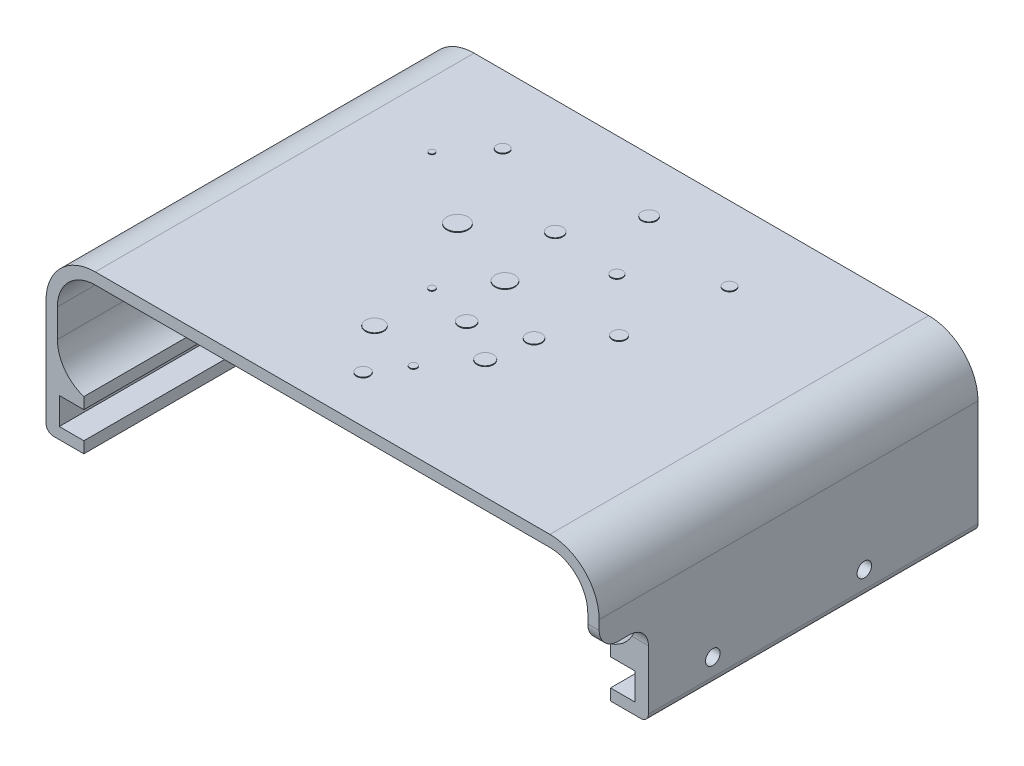
from build123d import *

# Parameters (mm, degrees)
BOSS_EXTRUDE1_DEPTH = 100
SKETCH2_R           = 1.925
CUT_EXTRUDE1_DEPTH  = 181.013888353
SKETCH3_W           = 10
SKETCH3_H           = 22.639392014
CUT_EXTRUDE2_DEPTH  = 13
FILLET1_R           = 5
SKETCH4_R           = 1.733173836
SKETCH4_R_2         = 0.981586666
SKETCH4_R_3         = 2.392571232
SKETCH4_R_4         = 2.109303231
SKETCH4_R_5         = 2.027090755
SKETCH4_R_6         = 2.155813145
SKETCH4_R_7         = 2.801748037
SKETCH4_R_8         = 1.588123218
SKETCH4_R_9         = 1.944759062
SKETCH4_R_10        = 2.597034209
SKETCH4_R_11        = 0.847315687
SKETCH4_R_12        = 1.785604619
SKETCH4_R_13        = 1.51506652
SKETCH4_R_14        = 2.019517128
SKETCH4_R_15        = 0.753353873
BOSS_EXTRUDE2_DEPTH = 0.2


with BuildPart() as part:
    # Sketch1 → Boss-Extrude1 (new body)
    with BuildSketch(Plane.XY):
        with BuildLine():
            Line((-63, -7.1), (-63, -10.1))
            Line((-63, -10.1), (-71, -10.1))
            ThreePointArc((-71, -10.1), (-72.414213562, -9.514213562), (-73, -8.1))
            Line((-73, -8.1), (-73, 20))
            ThreePointArc((-73, 20), (-69.192388155, 29.192388155), (-60, 33))
            Line((-60, 33), (60, 33))
            ThreePointArc((60, 33), (69.192388155, 29.192388155), (73, 20))
            Line((73, 20), (73, -8.1))
            ThreePointArc((73, -8.1), (72.414213562, -9.514213562), (71, -10.1))
            Line((71, -10.1), (63, -10.1))
            Line((63, -10.1), (63, -7.1))
            Line((63, -7.1), (69.5, -7.1))
            Line((69.5, -7.1), (69.5, 0))
            Line((69.5, 0), (63, 0))
            Line((63, 0), (63, 3))
            ThreePointArc((63, 3), (68.062257748, 6.623312231), (70, 12.539392014))
            Line((70, 12.539392014), (70, 20))
            ThreePointArc((70, 20), (67.071067812, 27.071067812), (60, 30))
            Line((60, 30), (-60, 30))
            ThreePointArc((-60, 30), (-67.071067812, 27.071067812), (-70, 20))
            Line((-70, 20), (-70, 12.539392014))
            ThreePointArc((-70, 12.539392014), (-68.062257748, 6.623312231), (-63, 3))
            Line((-63, 3), (-63, 0))
            Line((-63, 0), (-69.5, 0))
            Line((-69.5, 0), (-69.5, -7.1))
            Line((-69.5, -7.1), (-63, -7.1))
        make_face()
    extrude(amount=BOSS_EXTRUDE1_DEPTH)

    # Sketch2 → Cut-Extrude1 (cut, through all)
    with BuildSketch(Plane(origin=(73, 0, 0), x_dir=(0, 0, -1), z_dir=(1, 0, 0))):
        with Locations((-70, -3.55)):
            Circle(SKETCH2_R)
        with Locations((-30, -3.55)):
            Circle(SKETCH2_R)
    extrude(amount=-CUT_EXTRUDE1_DEPTH, mode=Mode.SUBTRACT)

    # Sketch3 → Cut-Extrude2 (cut)
    with BuildSketch(Plane.XY.offset(100)):
        with Locations((68, 1.219696007)):
            Rectangle(SKETCH3_W, SKETCH3_H)
    extrude(amount=-CUT_EXTRUDE2_DEPTH, mode=Mode.SUBTRACT)

    # Fillet1
    # the kernel refuses this fillet: 5 mm, written as the material it adds along each edge
    with BuildSketch(Plane(origin=(57.5, 12.539392014, 87), x_dir=(0, 0, 1), z_dir=(1, 0, 0))) as fillet1_piece_1_section:
        with BuildLine():
            CenterArc((FILLET1_R, FILLET1_R), FILLET1_R, 180, 90)
            Line((0, FILLET1_R), (0, 0))
            Line((0, 0), (FILLET1_R, 0))
        make_face()
    fillet1_piece_1 = extrude(amount=15.5, mode=Mode.PRIVATE)
    fillet1_piece_1 = fillet1_piece_1 - Plane(origin=(60, 12.539392014, 87.300010579), x_dir=(0.30000000000000276, -0.9539392014169449, 0), z_dir=(0, 0, -1)) * Cylinder(10, 52, mode=Mode.PRIVATE)
    add(fillet1_piece_1)
    # the kernel refuses this fillet: 5 mm, written as the material it takes off along each edge
    with BuildSketch(Plane(origin=(57.5, 12.539392014, 100), x_dir=(0, 1, 0), z_dir=(1, 0, 0))) as fillet1_2_piece_1:
        with BuildLine():
            CenterArc((FILLET1_R, -FILLET1_R), FILLET1_R, 90, 90)
            Line((0, -FILLET1_R), (0, 0))
            Line((0, 0), (FILLET1_R, 0))
        make_face()
    extrude(amount=28, mode=Mode.SUBTRACT)

    # Sketch4 → Boss-Extrude2 (add)
    with BuildSketch(Plane(origin=(0, 33, 0), x_dir=(1, 0, 0), z_dir=(0, 1, 0))):
        with Locations(Location((-1.621353912, -87.688909541, 0), (0, 0, 90))):
            Circle(SKETCH4_R)
        with Locations(Location((3.597208545, -79.608554769, 0), (0, 0, 90))):
            Circle(SKETCH4_R_2)
        with Locations(Location((-10.711753031, -75.568377383, 0), (0, 0, 90))):
            Circle(SKETCH4_R_3)
        with Locations(Location((0.487949319, -62.457213607, 0), (0, 0, 90))):
            Circle(SKETCH4_R_4)
        with Locations(Location((13.192629836, -57.387579146, 0), (0, 0, 90))):
            Circle(SKETCH4_R_5)
        with Locations(Location((11.615509985, -68.68582041, 0), (0, 0, 90))):
            Circle(SKETCH4_R_6)
        with Locations(Location((-23.168966637, -41.226869603, 0), (0, 0, 90))):
            Circle(SKETCH4_R_7)
        with Locations(Location((-34.279454449, -18.164190358, 0), (0, 0, 90))):
            Circle(SKETCH4_R_8)
        with Locations(Location((0.487949319, -14.292353696, 0), (0, 0, 90))):
            Circle(SKETCH4_R_9)
        with Locations(Location((27.164909963, -19.752313576, 0), (0, 0, 90))):
            Circle(SKETCH4_R_8)
        with Locations(Location((-3.730657143, -48.128839304, 0), (0, 0, 90))):
            Circle(SKETCH4_R_10)
        with Locations(Location((-11.721797377, -59.414669901, 0), (0, 0, 90))):
            Circle(SKETCH4_R_11)
        with Locations(Location((23.798095474, -45.531805095, 0), (0, 0, 90))):
            Circle(SKETCH4_R_12)
        with Locations(Location((9.489133899, -31.799789035, 0), (0, 0, 90))):
            Circle(SKETCH4_R_13)
        with Locations(Location((-8.319181799, -30.284722516, 0), (0, 0, 90))):
            Circle(SKETCH4_R_14)
        with Locations(Location((-42.864831394, -28.265205387, 0), (0, 0, 90))):
            Circle(SKETCH4_R_15)
    extrude(amount=BOSS_EXTRUDE2_DEPTH)


solid = part.part
